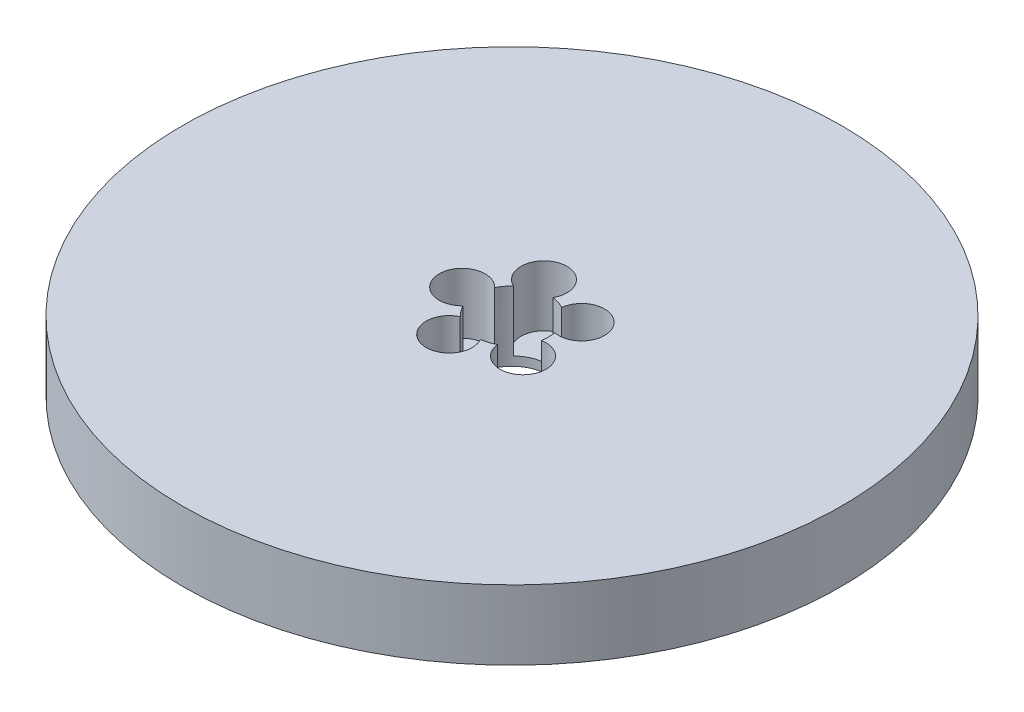
from build123d import *

# Parameters (mm, degrees)
SKETCH1_R           = 90
BOSS_EXTRUDE1_DEPTH = 19
SKETCH2_R           = 10
CUT_EXTRUDE1_DEPTH  = 129.689548915
SKETCH3_R           = 6.277196243
CUT_EXTRUDE2_DEPTH  = 16.549654973
CIRPATTERN1_COUNT   = 5


with BuildPart() as part:
    # Sketch1 → Boss-Extrude1 (new body)
    with BuildSketch(Plane(origin=(0, 0, 0), x_dir=(1, 0, 0), z_dir=(0, 1, 0))):
        Circle(SKETCH1_R)
    extrude(amount=BOSS_EXTRUDE1_DEPTH)

    # Sketch2 → Cut-Extrude1 (cut, through all)
    with BuildSketch(Plane(origin=(0, 0, 0), x_dir=(1, 0, 0), z_dir=(0, 1, 0))):
        Circle(SKETCH2_R)
    extrude(amount=CUT_EXTRUDE1_DEPTH, mode=Mode.SUBTRACT)

    # Sketch3 → Cut-Extrude2 (cut)
    with BuildSketch(Plane(origin=(0, 19, 0), x_dir=(1, 0, 0), z_dir=(0, 1, 0))):
        with Locations((-13.61267623, 0)):
            Circle(SKETCH3_R)
    cut_extrude2 = extrude(amount=-CUT_EXTRUDE2_DEPTH, mode=Mode.SUBTRACT)

    # CirPattern1: Cut-Extrude2 ×5 about axis
    cirpattern1_axis = Axis((0, 0, 0), (0, 1, 0))
    for i in range(1, CIRPATTERN1_COUNT):
        add(cut_extrude2.rotate(cirpattern1_axis, i * 360 / CIRPATTERN1_COUNT), mode=Mode.SUBTRACT)


solid = part.part
